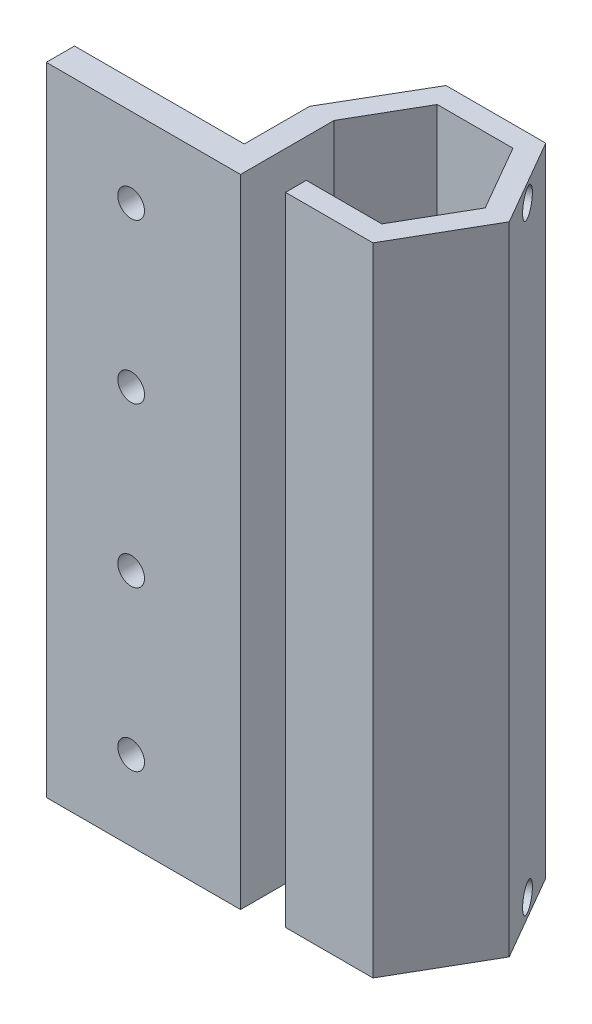
from build123d import *

# Parameters (mm, degrees)
BOSS_EXTRUDE3_DEPTH = 150
SKETCH5_R           = 3.15
CUT_EXTRUDE1_DEPTH  = 10
SKETCH6_R           = 3.15
CUT_EXTRUDE3_DEPTH  = 10
SKETCH7_W           = 23.498155956
SKETCH7_H           = 1.599424748
SKETCH7_H_2         = 1.6
BOSS_EXTRUDE4_DEPTH = 10


with BuildPart() as part:
    # Sketch4 → Boss-Extrude3 (new body)
    with BuildSketch(Plane(origin=(0, 0, 0), x_dir=(1, 0, 0), z_dir=(0, 1, 0))):
        Polygon((-17.811255804, 0.05), (-17.811255804, -22), (-63.584758496, -22), (-63.584758496, -15.35), (-23.584758496, -15.35), (-23.584758496, 0.05), (-11.749077978, 20.35), (11.749077978, 20.35), (23.498155956, 0), (11.749077978, -20.35), (-8.862326632, -20.35), (-8.862326632, -15.45), (8.920061659, -15.45), (17.840123318, 0), (8.920061659, 15.45), (-8.920061659, 15.45), align=None)
    extrude(amount=-BOSS_EXTRUDE3_DEPTH)

    # Sketch5 → Cut-Extrude1 (cut)
    with BuildSketch(Plane(origin=(0, 0, 15.35), x_dir=(-1, 0, 0), z_dir=(0, 0, -1))):
        with Locations((43.584758496, -131.25)):
            Circle(SKETCH5_R)
        with Locations((43.584758496, -93.75)):
            Circle(SKETCH5_R)
        with Locations((43.584758496, -56.25)):
            Circle(SKETCH5_R)
        with Locations((43.584758496, -18.75)):
            Circle(SKETCH5_R)
    extrude(amount=-CUT_EXTRUDE1_DEPTH, mode=Mode.SUBTRACT)

    # Sketch6 → Cut-Extrude3 (cut)
    with BuildSketch(Plane(origin=(17.623616967, 0, -10.175), x_dir=(-0.4999999999999999, 0, -0.8660254037844387), z_dir=(0.8660254037844387, 0, -0.4999999999999999))):
        with Locations((0, -4.15)):
            Circle(SKETCH6_R)
        with Locations((0, -145.85)):
            Circle(SKETCH6_R)
    extrude(amount=-CUT_EXTRUDE3_DEPTH, mode=Mode.SUBTRACT)

    # Sketch7 → Boss-Extrude4 (add)
    with BuildSketch(Plane(origin=(17.623616967, 0, -10.175), x_dir=(-0.4999999999999999, 0, -0.8660254037844387), z_dir=(0.8660254037844387, 0, -0.4999999999999999))):
        with Locations((0, -26.499712374)):
            Rectangle(SKETCH7_W, SKETCH7_H)
        with Locations((0, -123.5)):
            Rectangle(SKETCH7_W, SKETCH7_H_2)
    extrude(amount=-BOSS_EXTRUDE4_DEPTH)


solid = part.part
